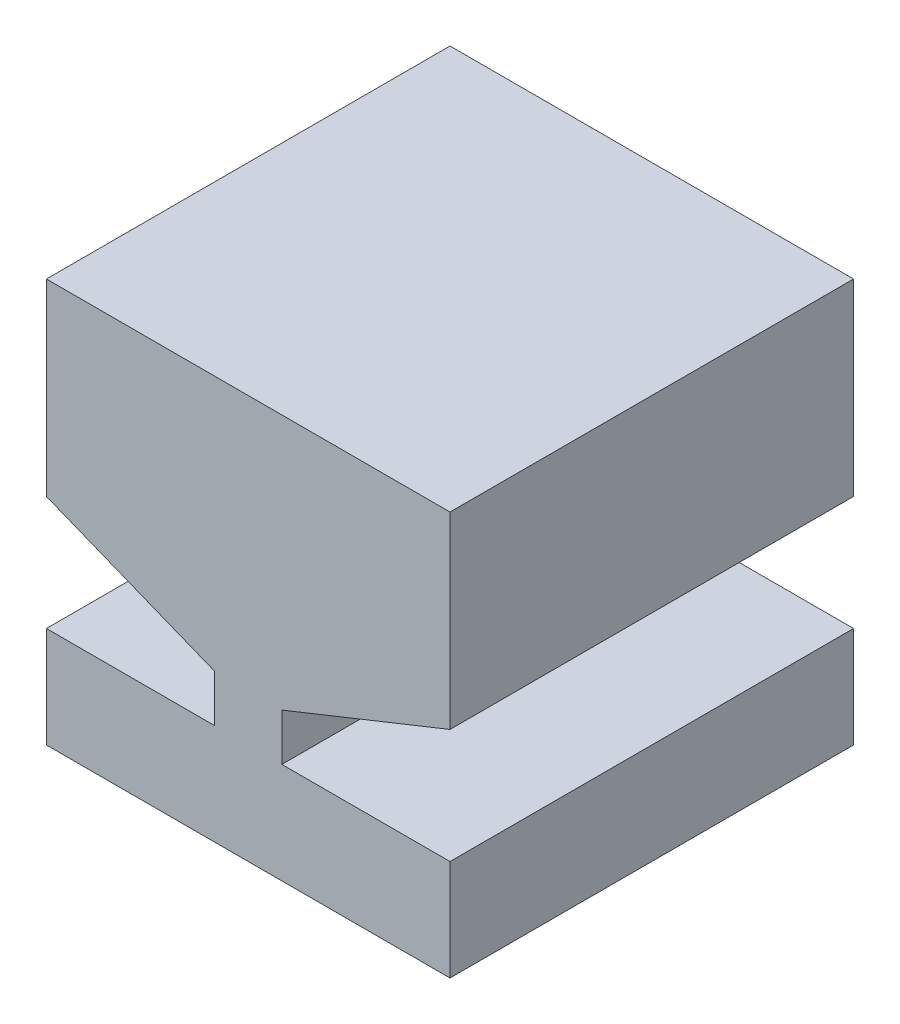
from build123d import *

# Parameters (mm, degrees)
BOSS_EXTRU_1_DEPTH = 60


with BuildPart() as part:
    # Esquisse1 → Boss.-Extru.1 (new body)
    with BuildSketch(Plane.XY):
        Polygon((0, 0), (60, 0), (60, 15), (35, 15), (35, 22), (60, 32), (60, 60), (0, 60), (0, 32), (25, 22), (25, 15), (0, 15), align=None)
    extrude(amount=BOSS_EXTRU_1_DEPTH)


solid = part.part
